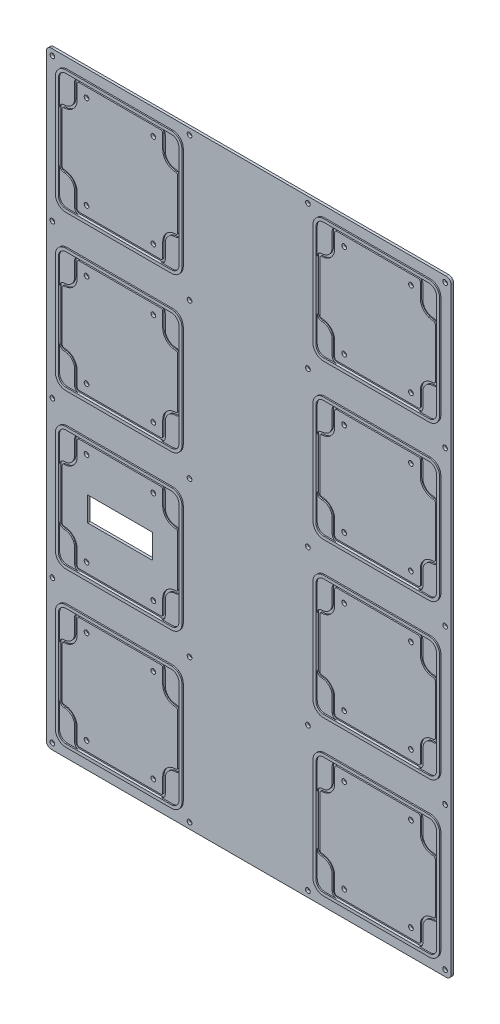
from build123d import *

# Parameters (mm, degrees)
SKETCH1_W            = 254
SKETCH1_H            = 381
BOSS_EXTRUDE1_DEPTH  = 1.5875
SKETCH2_R            = 1.4732
CUT_EXTRUDE1_DEPTH   = 458.907763809
FILLET1_R            = 3.175
CUT_EXTRUDE2_DEPTH   = 0.79375
BOSS_EXTRUDE2_DEPTH  = 0.79375
SKETCH5_R            = 1.4732
CUT_EXTRUDE3_DEPTH   = 458.907763809
LPATTERN1_COUNT      = 4
LPATTERN1_PITCH      = 96.8756
LPATTERN1_COUNT_DIR2 = 2
LPATTERN1_PITCH_DIR2 = 161.5948
SKETCH6_W            = 40.64
SKETCH6_H            = 15.24
CUT_EXTRUDE4_DEPTH   = 458.907763809


with BuildPart() as part:
    # Sketch1 → Boss-Extrude1 (new body)
    with BuildSketch(Plane.XY):
        with Locations((127, 190.5)):
            Rectangle(SKETCH1_W, SKETCH1_H)
    extrude(amount=BOSS_EXTRUDE1_DEPTH)

    # Sketch2 → Cut-Extrude1 (cut, through all)
    with BuildSketch(Plane.XY.offset(1.5875)):
        with Locations((3.81, 377.19)):
            Circle(SKETCH2_R)
        with Locations((89.8652, 377.19)):
            Circle(SKETCH2_R)
        with Locations((164.1348, 377.19)):
            Circle(SKETCH2_R)
        with Locations((250.19, 377.19)):
            Circle(SKETCH2_R)
        with Locations((164.1348, 287.375451288)):
            Circle(SKETCH2_R)
        with Locations((3.81, 287.3756)):
            Circle(SKETCH2_R)
        with Locations((250.19, 287.3756)):
            Circle(SKETCH2_R)
        with Locations((89.8652, 287.3756)):
            Circle(SKETCH2_R)
        with Locations((164.1348, 190.499990436)):
            Circle(SKETCH2_R)
        with Locations((3.81, 191.135)):
            Circle(SKETCH2_R)
        with Locations((250.19, 190.5)):
            Circle(SKETCH2_R)
        with Locations((89.8652, 190.5)):
            Circle(SKETCH2_R)
        with Locations((164.1348, 93.6244)):
            Circle(SKETCH2_R)
        with Locations((3.81, 93.6244)):
            Circle(SKETCH2_R)
        with Locations((250.19, 93.6244)):
            Circle(SKETCH2_R)
        with Locations((89.8652, 93.6244)):
            Circle(SKETCH2_R)
        with Locations((164.1348, 3.81)):
            Circle(SKETCH2_R)
        with Locations((3.81, 3.81)):
            Circle(SKETCH2_R)
        with Locations((250.19, 3.81)):
            Circle(SKETCH2_R)
        with Locations((89.8652, 3.81)):
            Circle(SKETCH2_R)
    extrude(amount=-CUT_EXTRUDE1_DEPTH, mode=Mode.SUBTRACT)

    # Fillet1
    fillet1_edges = [part.edges().sort_by_distance(p)[0] for p in [
        (254, 0, 0.79375),
        (0, 0, 0.79375),
        (254, 381, 0.79375),
        (0, 381, 0.79375),
    ]]
    fillet(fillet1_edges, radius=FILLET1_R)

    # Sketch3 → Cut-Extrude2 (cut)
    with BuildSketch(Plane.XY.offset(1.5875)):
        with BuildLine():
            Line((17.78, 79.1718), (17.78, 70.1802))
            ThreePointArc((17.78, 70.1802), (15.853172671, 65.528427329), (11.2014, 63.6016))
            ThreePointArc((11.2014, 63.6016), (9.207783141, 62.775816859), (8.382, 60.7822))
            Line((8.382, 60.7822), (8.382, 29.591))
            ThreePointArc((8.382, 29.591), (9.207783141, 27.597383141), (11.2014, 26.7716))
            ThreePointArc((11.2014, 26.7716), (15.853172671, 24.844772671), (17.78, 20.193))
            Line((17.78, 20.193), (17.78, 11.2014))
            ThreePointArc((17.78, 11.2014), (18.605783141, 9.207783141), (20.5994, 8.382))
            Line((20.5994, 8.382), (71.8058, 8.382))
            ThreePointArc((71.8058, 8.382), (73.799416859, 9.207783141), (74.6252, 11.2014))
            Line((74.6252, 11.2014), (74.6252, 20.193))
            ThreePointArc((74.6252, 20.193), (76.552027329, 24.844772671), (81.2038, 26.7716))
            ThreePointArc((81.2038, 26.7716), (83.197416859, 27.597383141), (84.0232, 29.591))
            Line((84.0232, 29.591), (84.0232, 60.7822))
            ThreePointArc((84.0232, 60.7822), (83.197416859, 62.775816859), (81.2038, 63.6016))
            ThreePointArc((81.2038, 63.6016), (76.552027329, 65.528427329), (74.6252, 70.1802))
            Line((74.6252, 70.1802), (74.6252, 79.1718))
            ThreePointArc((74.6252, 79.1718), (73.799416859, 81.165416859), (71.8058, 81.9912))
            Line((71.8058, 81.9912), (20.5994, 81.9912))
            ThreePointArc((20.5994, 81.9912), (18.605783141, 81.165416859), (17.78, 79.1718))
        make_face()
        with BuildLine():
            Line((82.4357, 29.591), (82.4357, 60.7822))
            ThreePointArc((82.4357, 60.7822), (82.074884844, 61.653284844), (81.2038, 62.0141))
            ThreePointArc((81.2038, 62.0141), (75.429495314, 64.405895314), (73.0377, 70.1802))
            Line((73.0377, 70.1802), (73.0377, 79.1718))
            ThreePointArc((73.0377, 79.1718), (72.676884844, 80.042884844), (71.8058, 80.4037))
            Line((71.8058, 80.4037), (20.5994, 80.4037))
            ThreePointArc((20.5994, 80.4037), (19.728315156, 80.042884844), (19.3675, 79.1718))
            Line((19.3675, 79.1718), (19.3675, 70.1802))
            ThreePointArc((19.3675, 70.1802), (16.975704686, 64.405895314), (11.2014, 62.0141))
            ThreePointArc((11.2014, 62.0141), (10.330315156, 61.653284844), (9.9695, 60.7822))
            Line((9.9695, 60.7822), (9.9695, 29.591))
            ThreePointArc((9.9695, 29.591), (10.330315156, 28.719915156), (11.2014, 28.3591))
            ThreePointArc((11.2014, 28.3591), (16.975704686, 25.967304686), (19.3675, 20.193))
            Line((19.3675, 20.193), (19.3675, 11.2014))
            ThreePointArc((19.3675, 11.2014), (19.728315156, 10.330315156), (20.5994, 9.9695))
            Line((20.5994, 9.9695), (71.8058, 9.9695))
            ThreePointArc((71.8058, 9.9695), (72.676884844, 10.330315156), (73.0377, 11.2014))
            Line((73.0377, 11.2014), (73.0377, 20.193))
            ThreePointArc((73.0377, 20.193), (75.429495314, 25.967304686), (81.2038, 28.3591))
            ThreePointArc((81.2038, 28.3591), (82.074884844, 28.719915156), (82.4357, 29.591))
        make_face(mode=Mode.SUBTRACT)
    cut_extrude2 = extrude(amount=-CUT_EXTRUDE2_DEPTH, mode=Mode.SUBTRACT)

    # Sketch4 → Boss-Extrude2 (add)
    with BuildSketch(Plane.XY.offset(1.5875)):
        with BuildLine():
            Line((6.477, 60.7822), (6.477, 77.2287))
            ThreePointArc((6.477, 77.2287), (8.429865536, 81.943334464), (13.1445, 83.8962))
            Line((13.1445, 83.8962), (20.5994, 83.8962))
            Line((20.5994, 83.8962), (79.2607, 83.8962))
            ThreePointArc((79.2607, 83.8962), (83.975334464, 81.943334464), (85.9282, 77.2287))
            Line((85.9282, 77.2287), (85.9282, 13.1445))
            ThreePointArc((85.9282, 13.1445), (83.975334464, 8.429865536), (79.2607, 6.477))
            Line((79.2607, 6.477), (13.1445, 6.477))
            ThreePointArc((13.1445, 6.477), (8.429865536, 8.429865536), (6.477, 13.1445))
            Line((6.477, 13.1445), (6.477, 60.7822))
        make_face()
        with BuildLine():
            Line((8.382, 60.7822), (8.382, 77.2287))
            ThreePointArc((8.382, 77.2287), (9.776903955, 80.596296045), (13.1445, 81.9912))
            Line((13.1445, 81.9912), (20.5994, 81.9912))
            Line((20.5994, 81.9912), (79.2607, 81.9912))
            ThreePointArc((79.2607, 81.9912), (82.628296045, 80.596296045), (84.0232, 77.2287))
            Line((84.0232, 77.2287), (84.0232, 13.1445))
            ThreePointArc((84.0232, 13.1445), (82.628296045, 9.776903955), (79.2607, 8.382))
            Line((79.2607, 8.382), (13.1445, 8.382))
            ThreePointArc((13.1445, 8.382), (9.776903955, 9.776903955), (8.382, 13.1445))
            Line((8.382, 13.1445), (8.382, 60.7822))
        make_face(mode=Mode.SUBTRACT)
    boss_extrude2 = extrude(amount=BOSS_EXTRUDE2_DEPTH)

    # Sketch5 → Cut-Extrude3 (cut, through all)
    with BuildSketch(Plane.XY.offset(1.5875)):
        with Locations((25.2476, 74.3966)):
            Circle(SKETCH5_R)
        with Locations((67.1576, 74.3966)):
            Circle(SKETCH5_R)
        with Locations((67.1576, 15.9766)):
            Circle(SKETCH5_R)
        with Locations((25.2476, 15.9766)):
            Circle(SKETCH5_R)
    cut_extrude3 = extrude(amount=-CUT_EXTRUDE3_DEPTH, mode=Mode.SUBTRACT)

    # LPattern1: Cut-Extrude2, Boss-Extrude2, Cut-Extrude3 4 × 2
    with Locations(*[(j * LPATTERN1_PITCH_DIR2, i * LPATTERN1_PITCH, 0) for i in range(LPATTERN1_COUNT) for j in range(LPATTERN1_COUNT_DIR2) if (i, j) != (0, 0)]):
        add(cut_extrude2, mode=Mode.SUBTRACT)
        add(boss_extrude2)
        add(cut_extrude3, mode=Mode.SUBTRACT)

    # Sketch6 → Cut-Extrude4 (cut, through all)
    with BuildSketch(Plane.XY.offset(1.5875)):
        with Locations((46.2026, 142.0622)):
            Rectangle(SKETCH6_W, SKETCH6_H)
    extrude(amount=-CUT_EXTRUDE4_DEPTH, mode=Mode.SUBTRACT)


solid = part.part
